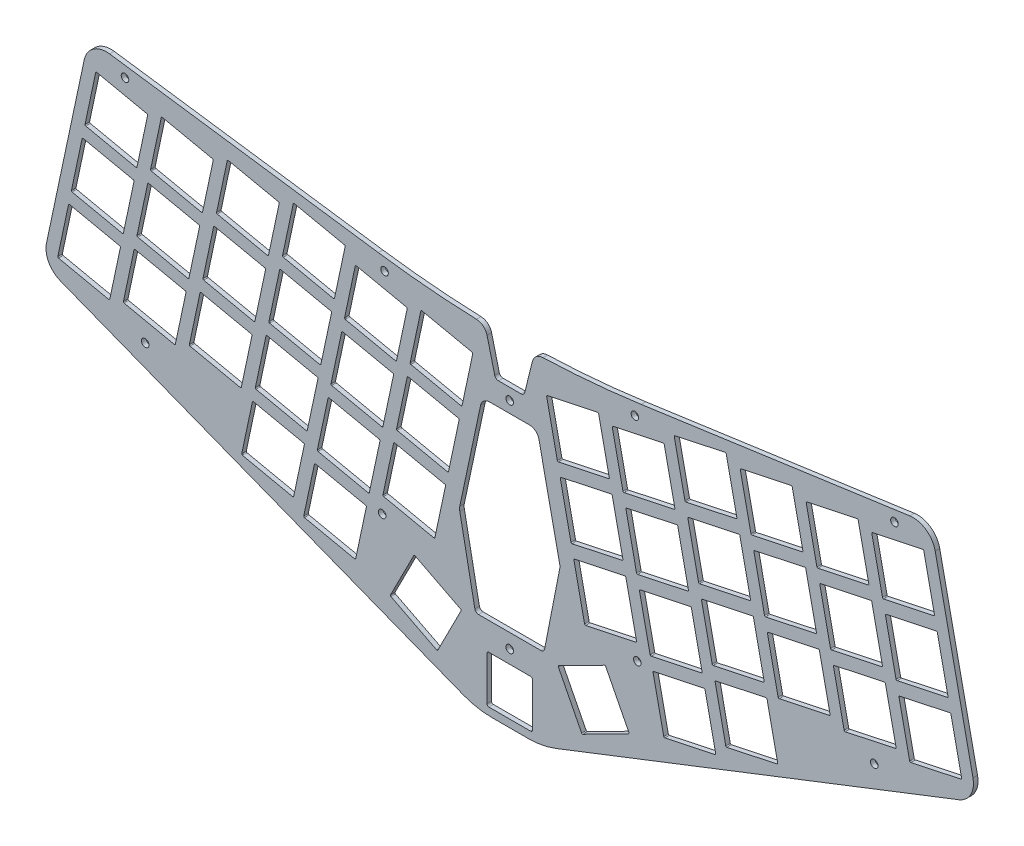
from build123d import *

# Parameters (mm, degrees)
MODEL_R             = 1
BOSS_EXTRUDE1_DEPTH = 1.2


with BuildPart() as part:
    # Model → Boss-Extrude1 (new body)
    with BuildSketch(Plane.XY):
        with BuildLine():
            Line((118.9760866, -36.3417418), (119.338629114, -36.3417418))
            ThreePointArc((119.338629114, -36.3417418), (123.033383047, -35.997499058), (126.600947758, -34.976621137))
            Line((126.600947758, -34.976621137), (130.217772945, -33.567084938))
            Line((130.217772945, -33.567084938), (232.915297986, 6.455827865))
            ThreePointArc((232.915297986, 6.455827865), (236.0167753, 9.19676994), (236.605487998, 13.293761806))
            Line((236.605487998, 13.293761806), (226.655780482, 60.103455566))
            ThreePointArc((226.655780482, 60.103455566), (224.228353496, 63.77089769), (219.95185627, 64.797593838))
            Line((219.95185627, 64.797593838), (149.130188739, 54.844257568))
            ThreePointArc((149.130188739, 54.844257568), (136.222632248, 53.372447422), (123.255880075, 52.575843528))
            ThreePointArc((123.255880075, 52.575843528), (121.473278822, 51.908806158), (120.45077354, 50.303474719))
            Line((120.45077354, 50.303474719), (118.425135625, 42.179084789))
            ThreePointArc((118.425135625, 42.179084789), (118.070501374, 41.632995931), (117.454839898, 41.421006685))
            Line((117.454839898, 41.421006685), (111.497333302, 41.421006685))
            ThreePointArc((111.497333302, 41.421006685), (110.881671826, 41.632995931), (110.527037575, 42.179084789))
            Line((110.527037575, 42.179084789), (108.50139966, 50.303474719))
            ThreePointArc((108.50139966, 50.303474719), (107.478894378, 51.908806158), (105.696293125, 52.575843528))
            ThreePointArc((105.696293125, 52.575843528), (92.729540952, 53.372447422), (79.821984461, 54.844257568))
            Line((79.821984461, 54.844257568), (9.00031693, 64.797593838))
            ThreePointArc((9.00031693, 64.797593838), (4.723819704, 63.77089769), (2.296392718, 60.103455566))
            Line((2.296392718, 60.103455566), (-7.653314798, 13.293761806))
            ThreePointArc((-7.653314798, 13.293761806), (-7.0646021, 9.19676994), (-3.963124786, 6.455827865))
            Line((-3.963124786, 6.455827865), (98.734400255, -33.567084938))
            Line((98.734400255, -33.567084938), (102.351225442, -34.976621137))
            ThreePointArc((102.351225442, -34.976621137), (105.918790153, -35.997499058), (109.613544086, -36.3417418))
            Line((109.613544086, -36.3417418), (109.9760866, -36.3417418))
            Line((109.9760866, -36.3417418), (114.4760866, -36.3417418))
            Line((114.4760866, -36.3417418), (118.9760866, -36.3417418))
        make_face()
        with Locations((215.905714612, 61.37876191)):
            Circle(MODEL_R, mode=Mode.SUBTRACT)
        with Locations((13.046458588, 61.37876191)):
            Circle(MODEL_R, mode=Mode.SUBTRACT)
        with Locations((148.11144187, -4.309774147)):
            Circle(MODEL_R, mode=Mode.SUBTRACT)
        with Locations((80.84073133, -4.309774147)):
            Circle(MODEL_R, mode=Mode.SUBTRACT)
        with Locations((210.571767278, 3.505093389)):
            Circle(MODEL_R, mode=Mode.SUBTRACT)
        with Locations((147.477927512, 51.43451951)):
            Circle(MODEL_R, mode=Mode.SUBTRACT)
        with Locations((81.474245688, 51.43451951)):
            Circle(MODEL_R, mode=Mode.SUBTRACT)
        with Locations((18.380405922, 3.505093389)):
            Circle(MODEL_R, mode=Mode.SUBTRACT)
        with Locations((114.4760866, -18.3417418)):
            Circle(MODEL_R, mode=Mode.SUBTRACT)
        with Locations((114.4760866, 38.421006685)):
            Circle(MODEL_R, mode=Mode.SUBTRACT)
        with BuildLine():
            Line((119.9760866, -34.3417418), (108.9760866, -34.3417418))
            ThreePointArc((108.9760866, -34.3417418), (108.622533209, -34.195295191), (108.4760866, -33.8417418))
            Line((108.4760866, -33.8417418), (108.4760866, -22.3417418))
            ThreePointArc((108.4760866, -22.3417418), (108.622533209, -21.988188409), (108.9760866, -21.8417418))
            Line((108.9760866, -21.8417418), (119.9760866, -21.8417418))
            ThreePointArc((119.9760866, -21.8417418), (120.329639991, -21.988188409), (120.4760866, -22.3417418))
            Line((120.4760866, -22.3417418), (120.4760866, -33.8417418))
            ThreePointArc((120.4760866, -33.8417418), (120.329639991, -34.195295191), (119.9760866, -34.3417418))
        make_face(mode=Mode.SUBTRACT)
        with BuildLine():
            Line((123.671373637, -13.757755399), (127.643452867, 6.515489672))
            ThreePointArc((127.643452867, 6.515489672), (127.699331998, 7.116248716), (127.633870359, 7.716039245))
            Line((127.633870359, 7.716039245), (122.165906686, 33.44078591))
            ThreePointArc((122.165906686, 33.44078591), (121.293838662, 34.863871588), (119.720537684, 35.421006685))
            Line((119.720537684, 35.421006685), (119.4760866, 35.421006685))
            Line((119.4760866, 35.421006685), (109.4760866, 35.421006685))
            Line((109.4760866, 35.421006685), (109.231635516, 35.421006685))
            ThreePointArc((109.231635516, 35.421006685), (107.658334538, 34.863871588), (106.786266514, 33.44078591))
            Line((106.786266514, 33.44078591), (101.318302841, 7.716039245))
            ThreePointArc((101.318302841, 7.716039245), (101.252841202, 7.116248716), (101.308720333, 6.515489672))
            Line((101.308720333, 6.515489672), (105.280799563, -13.757755399))
            ThreePointArc((105.280799563, -13.757755399), (105.626638186, -14.337582176), (106.262141333, -14.565483898))
            Line((106.262141333, -14.565483898), (122.690031867, -14.565483898))
            ThreePointArc((122.690031867, -14.565483898), (123.325535014, -14.337582176), (123.671373637, -13.757755399))
        make_face(mode=Mode.SUBTRACT)
        with BuildLine():
            Line((230.512810978, 25.123483213), (217.307818365, 22.3166754))
            ThreePointArc((217.307818365, 22.3166754), (217.150128645, 22.208298259), (217.115259387, 22.020160578))
            Line((217.115259387, 22.020160578), (219.9220672, 8.815167965))
            ThreePointArc((219.9220672, 8.815167965), (220.030444341, 8.657478245), (220.218582022, 8.622608987))
            Line((220.218582022, 8.622608987), (233.423574635, 11.4294168))
            ThreePointArc((233.423574635, 11.4294168), (233.581264355, 11.537793941), (233.616133613, 11.725931622))
            Line((233.616133613, 11.725931622), (230.8093258, 24.930924235))
            ThreePointArc((230.8093258, 24.930924235), (230.700948659, 25.088613955), (230.512810978, 25.123483213))
        make_face(mode=Mode.SUBTRACT)
        with BuildLine():
            Line((226.926334378, 41.996529313), (213.721341765, 39.1897215))
            ThreePointArc((213.721341765, 39.1897215), (213.563652045, 39.081344359), (213.528782787, 38.893206678))
            Line((213.528782787, 38.893206678), (216.3355906, 25.688214065))
            ThreePointArc((216.3355906, 25.688214065), (216.443967741, 25.530524345), (216.632105422, 25.495655087))
            Line((216.632105422, 25.495655087), (229.837098035, 28.3024629))
            ThreePointArc((229.837098035, 28.3024629), (229.994787755, 28.410840041), (230.029657013, 28.598977722))
            Line((230.029657013, 28.598977722), (227.2228492, 41.803970335))
            ThreePointArc((227.2228492, 41.803970335), (227.114472059, 41.961660055), (226.926334378, 41.996529313))
        make_face(mode=Mode.SUBTRACT)
        with BuildLine():
            Line((223.339857678, 58.869575413), (210.134865065, 56.0627676))
            ThreePointArc((210.134865065, 56.0627676), (209.977175345, 55.954390459), (209.942306087, 55.766252778))
            Line((209.942306087, 55.766252778), (212.7491139, 42.561260165))
            ThreePointArc((212.7491139, 42.561260165), (212.857491041, 42.403570445), (213.045628722, 42.368701187))
            Line((213.045628722, 42.368701187), (226.250621335, 45.175509))
            ThreePointArc((226.250621335, 45.175509), (226.408311055, 45.283886141), (226.443180313, 45.472023822))
            Line((226.443180313, 45.472023822), (223.6363725, 58.677016435))
            ThreePointArc((223.6363725, 58.677016435), (223.527995359, 58.834706155), (223.339857678, 58.869575413))
        make_face(mode=Mode.SUBTRACT)
        with BuildLine():
            Line((213.223941478, 23.493301713), (200.018948865, 20.6864939))
            ThreePointArc((200.018948865, 20.6864939), (199.861259145, 20.578116759), (199.826389887, 20.389979078))
            Line((199.826389887, 20.389979078), (202.6331977, 7.184986465))
            ThreePointArc((202.6331977, 7.184986465), (202.741574841, 7.027296745), (202.929712522, 6.992427487))
            Line((202.929712522, 6.992427487), (216.134705135, 9.7992353))
            ThreePointArc((216.134705135, 9.7992353), (216.292394855, 9.907612441), (216.327264113, 10.095750122))
            Line((216.327264113, 10.095750122), (213.5204563, 23.300742735))
            ThreePointArc((213.5204563, 23.300742735), (213.412079159, 23.458432455), (213.223941478, 23.493301713))
        make_face(mode=Mode.SUBTRACT)
        with BuildLine():
            Line((209.637464878, 40.366347913), (196.432472265, 37.5595401))
            ThreePointArc((196.432472265, 37.5595401), (196.274782545, 37.451162959), (196.239913287, 37.263025278))
            Line((196.239913287, 37.263025278), (199.0467211, 24.058032665))
            ThreePointArc((199.0467211, 24.058032665), (199.155098241, 23.900342945), (199.343235922, 23.865473687))
            Line((199.343235922, 23.865473687), (212.548228535, 26.6722815))
            ThreePointArc((212.548228535, 26.6722815), (212.705918255, 26.780658641), (212.740787513, 26.968796322))
            Line((212.740787513, 26.968796322), (209.9339797, 40.173788935))
            ThreePointArc((209.9339797, 40.173788935), (209.825602559, 40.331478655), (209.637464878, 40.366347913))
        make_face(mode=Mode.SUBTRACT)
        with BuildLine():
            Line((206.050988178, 57.239394013), (192.845995565, 54.4325862))
            ThreePointArc((192.845995565, 54.4325862), (192.688305845, 54.324209059), (192.653436587, 54.136071378))
            Line((192.653436587, 54.136071378), (195.4602444, 40.931078765))
            ThreePointArc((195.4602444, 40.931078765), (195.568621541, 40.773389045), (195.756759222, 40.738519787))
            Line((195.756759222, 40.738519787), (208.961751835, 43.5453276))
            ThreePointArc((208.961751835, 43.5453276), (209.119441555, 43.653704741), (209.154310813, 43.841842422))
            Line((209.154310813, 43.841842422), (206.347503, 57.046835035))
            ThreePointArc((206.347503, 57.046835035), (206.239125859, 57.204524755), (206.050988178, 57.239394013))
        make_face(mode=Mode.SUBTRACT)
        with BuildLine():
            Line((195.831116178, 22.352194113), (182.626123565, 19.5453863))
            ThreePointArc((182.626123565, 19.5453863), (182.468433845, 19.437009159), (182.433564587, 19.248871478))
            Line((182.433564587, 19.248871478), (185.2403724, 6.043878865))
            ThreePointArc((185.2403724, 6.043878865), (185.348749541, 5.886189145), (185.536887222, 5.851319887))
            Line((185.536887222, 5.851319887), (198.741879835, 8.6581277))
            ThreePointArc((198.741879835, 8.6581277), (198.899569555, 8.766504841), (198.934438813, 8.954642522))
            Line((198.934438813, 8.954642522), (196.127631, 22.159635135))
            ThreePointArc((196.127631, 22.159635135), (196.019253859, 22.317324855), (195.831116178, 22.352194113))
        make_face(mode=Mode.SUBTRACT)
        with BuildLine():
            Line((192.244639478, 39.225240213), (179.039646865, 36.4184324))
            ThreePointArc((179.039646865, 36.4184324), (178.881957145, 36.310055259), (178.847087887, 36.121917578))
            Line((178.847087887, 36.121917578), (181.6538957, 22.916924965))
            ThreePointArc((181.6538957, 22.916924965), (181.762272841, 22.759235245), (181.950410522, 22.724365987))
            Line((181.950410522, 22.724365987), (195.155403135, 25.5311738))
            ThreePointArc((195.155403135, 25.5311738), (195.313092855, 25.639550941), (195.347962113, 25.827688622))
            Line((195.347962113, 25.827688622), (192.5411543, 39.032681235))
            ThreePointArc((192.5411543, 39.032681235), (192.432777159, 39.190370955), (192.244639478, 39.225240213))
        make_face(mode=Mode.SUBTRACT)
        with BuildLine():
            Line((188.658162878, 56.098286313), (175.453170265, 53.2914785))
            ThreePointArc((175.453170265, 53.2914785), (175.295480545, 53.183101359), (175.260611287, 52.994963678))
            Line((175.260611287, 52.994963678), (178.0674191, 39.789971065))
            ThreePointArc((178.0674191, 39.789971065), (178.175796241, 39.632281345), (178.363933922, 39.597412087))
            Line((178.363933922, 39.597412087), (191.568926535, 42.4042199))
            ThreePointArc((191.568926535, 42.4042199), (191.726616255, 42.512597041), (191.761485513, 42.700734722))
            Line((191.761485513, 42.700734722), (188.9546777, 55.905727335))
            ThreePointArc((188.9546777, 55.905727335), (188.846300559, 56.063417055), (188.658162878, 56.098286313))
        make_face(mode=Mode.SUBTRACT)
        with BuildLine():
            Line((182.024767478, 4.338040313), (168.819774865, 1.5312325))
            ThreePointArc((168.819774865, 1.5312325), (168.662085145, 1.422855359), (168.627215887, 1.234717678))
            Line((168.627215887, 1.234717678), (171.4340237, -11.970274935))
            ThreePointArc((171.4340237, -11.970274935), (171.542400841, -12.127964655), (171.730538522, -12.162833913))
            Line((171.730538522, -12.162833913), (184.935531135, -9.3560261))
            ThreePointArc((184.935531135, -9.3560261), (185.093220855, -9.247648959), (185.128090113, -9.059511278))
            Line((185.128090113, -9.059511278), (182.3212823, 4.145481335))
            ThreePointArc((182.3212823, 4.145481335), (182.212905159, 4.303171055), (182.024767478, 4.338040313))
        make_face(mode=Mode.SUBTRACT)
        with BuildLine():
            Line((178.438290878, 21.211086413), (165.233298265, 18.4042786))
            ThreePointArc((165.233298265, 18.4042786), (165.075608545, 18.295901459), (165.040739287, 18.107763778))
            Line((165.040739287, 18.107763778), (167.8475471, 4.902771165))
            ThreePointArc((167.8475471, 4.902771165), (167.955924241, 4.745081445), (168.144061922, 4.710212187))
            Line((168.144061922, 4.710212187), (181.349054535, 7.51702))
            ThreePointArc((181.349054535, 7.51702), (181.506744255, 7.625397141), (181.541613513, 7.813534822))
            Line((181.541613513, 7.813534822), (178.7348057, 21.018527435))
            ThreePointArc((178.7348057, 21.018527435), (178.626428559, 21.176217155), (178.438290878, 21.211086413))
        make_face(mode=Mode.SUBTRACT)
        with BuildLine():
            Line((174.851814178, 38.084132513), (161.646821565, 35.2773247))
            ThreePointArc((161.646821565, 35.2773247), (161.489131845, 35.168947559), (161.454262587, 34.980809878))
            Line((161.454262587, 34.980809878), (164.2610704, 21.775817265))
            ThreePointArc((164.2610704, 21.775817265), (164.369447541, 21.618127545), (164.557585222, 21.583258287))
            Line((164.557585222, 21.583258287), (177.762577835, 24.3900661))
            ThreePointArc((177.762577835, 24.3900661), (177.920267555, 24.498443241), (177.955136813, 24.686580922))
            Line((177.955136813, 24.686580922), (175.148329, 37.891573535))
            ThreePointArc((175.148329, 37.891573535), (175.039951859, 38.049263255), (174.851814178, 38.084132513))
        make_face(mode=Mode.SUBTRACT)
        with BuildLine():
            Line((171.265337478, 54.957178613), (158.060344865, 52.1503708))
            ThreePointArc((158.060344865, 52.1503708), (157.902655145, 52.041993659), (157.867785887, 51.853855978))
            Line((157.867785887, 51.853855978), (160.6745937, 38.648863365))
            ThreePointArc((160.6745937, 38.648863365), (160.782970841, 38.491173645), (160.971108522, 38.456304387))
            Line((160.971108522, 38.456304387), (174.176101135, 41.2631122))
            ThreePointArc((174.176101135, 41.2631122), (174.333790855, 41.371489341), (174.368660113, 41.559627022))
            Line((174.368660113, 41.559627022), (171.5618523, 54.764619635))
            ThreePointArc((171.5618523, 54.764619635), (171.453475159, 54.922309355), (171.265337478, 54.957178613))
        make_face(mode=Mode.SUBTRACT)
        with BuildLine():
            Line((165.671500578, -1.693805387), (152.466507965, -4.5006132))
            ThreePointArc((152.466507965, -4.5006132), (152.308818245, -4.608990341), (152.273948987, -4.797128022))
            Line((152.273948987, -4.797128022), (155.0807568, -18.002120635))
            ThreePointArc((155.0807568, -18.002120635), (155.189133941, -18.159810355), (155.377271622, -18.194679613))
            Line((155.377271622, -18.194679613), (168.582264235, -15.3878718))
            ThreePointArc((168.582264235, -15.3878718), (168.739953955, -15.279494659), (168.774823213, -15.091356978))
            Line((168.774823213, -15.091356978), (165.9680154, -1.886364365))
            ThreePointArc((165.9680154, -1.886364365), (165.859638259, -1.728674645), (165.671500578, -1.693805387))
        make_face(mode=Mode.SUBTRACT)
        with BuildLine():
            Line((162.085023978, 15.179240713), (148.880031365, 12.3724329))
            ThreePointArc((148.880031365, 12.3724329), (148.722341645, 12.264055759), (148.687472387, 12.075918078))
            Line((148.687472387, 12.075918078), (151.4942802, -1.129074535))
            ThreePointArc((151.4942802, -1.129074535), (151.602657341, -1.286764255), (151.790795022, -1.321633513))
            Line((151.790795022, -1.321633513), (164.995787635, 1.4851743))
            ThreePointArc((164.995787635, 1.4851743), (165.153477355, 1.593551441), (165.188346613, 1.781689122))
            Line((165.188346613, 1.781689122), (162.3815388, 14.986681735))
            ThreePointArc((162.3815388, 14.986681735), (162.273161659, 15.144371455), (162.085023978, 15.179240713))
        make_face(mode=Mode.SUBTRACT)
        with BuildLine():
            Line((158.498547278, 32.052286913), (145.293554665, 29.2454791))
            ThreePointArc((145.293554665, 29.2454791), (145.135864945, 29.137101959), (145.100995687, 28.948964278))
            Line((145.100995687, 28.948964278), (147.9078035, 15.743971665))
            ThreePointArc((147.9078035, 15.743971665), (148.016180641, 15.586281945), (148.204318322, 15.551412687))
            Line((148.204318322, 15.551412687), (161.409310935, 18.3582205))
            ThreePointArc((161.409310935, 18.3582205), (161.567000655, 18.466597641), (161.601869913, 18.654735322))
            Line((161.601869913, 18.654735322), (158.7950621, 31.859727935))
            ThreePointArc((158.7950621, 31.859727935), (158.686684959, 32.017417655), (158.498547278, 32.052286913))
        make_face(mode=Mode.SUBTRACT)
        with BuildLine():
            Line((154.912070578, 48.925333013), (141.707077965, 46.1185252))
            ThreePointArc((141.707077965, 46.1185252), (141.549388245, 46.010148059), (141.514518987, 45.822010378))
            Line((141.514518987, 45.822010378), (144.3213268, 32.617017765))
            ThreePointArc((144.3213268, 32.617017765), (144.429703941, 32.459328045), (144.617841622, 32.424458787))
            Line((144.617841622, 32.424458787), (157.822834235, 35.2312666))
            ThreePointArc((157.822834235, 35.2312666), (157.980523955, 35.339643741), (158.015393213, 35.527781422))
            Line((158.015393213, 35.527781422), (155.2085854, 48.732774035))
            ThreePointArc((155.2085854, 48.732774035), (155.100208259, 48.890463755), (154.912070578, 48.925333013))
        make_face(mode=Mode.SUBTRACT)
        with BuildLine():
            Line((137.623201078, 47.295151513), (124.418208465, 44.4883437))
            ThreePointArc((124.418208465, 44.4883437), (124.260518745, 44.379966559), (124.225649487, 44.191828878))
            Line((124.225649487, 44.191828878), (127.0324573, 30.986836265))
            ThreePointArc((127.0324573, 30.986836265), (127.140834441, 30.829146545), (127.328972122, 30.794277287))
            Line((127.328972122, 30.794277287), (140.533964735, 33.6010851))
            ThreePointArc((140.533964735, 33.6010851), (140.691654455, 33.709462241), (140.726523713, 33.897599922))
            Line((140.726523713, 33.897599922), (137.9197159, 47.102592535))
            ThreePointArc((137.9197159, 47.102592535), (137.811338759, 47.260282255), (137.623201078, 47.295151513))
        make_face(mode=Mode.SUBTRACT)
        with BuildLine():
            Line((141.209677778, 30.422105413), (128.004685165, 27.6152976))
            ThreePointArc((128.004685165, 27.6152976), (127.846995445, 27.506920459), (127.812126187, 27.318782778))
            Line((127.812126187, 27.318782778), (130.618934, 14.113790165))
            ThreePointArc((130.618934, 14.113790165), (130.727311141, 13.956100445), (130.915448822, 13.921231187))
            Line((130.915448822, 13.921231187), (144.120441435, 16.728039))
            ThreePointArc((144.120441435, 16.728039), (144.278131155, 16.836416141), (144.313000413, 17.024553822))
            Line((144.313000413, 17.024553822), (141.5061926, 30.229546435))
            ThreePointArc((141.5061926, 30.229546435), (141.397815459, 30.387236155), (141.209677778, 30.422105413))
        make_face(mode=Mode.SUBTRACT)
        with BuildLine():
            Line((144.796154478, 13.549059313), (131.591161865, 10.7422515))
            ThreePointArc((131.591161865, 10.7422515), (131.433472145, 10.633874359), (131.398602887, 10.445736678))
            Line((131.398602887, 10.445736678), (134.2054107, -2.759255935))
            ThreePointArc((134.2054107, -2.759255935), (134.313787841, -2.916945655), (134.501925522, -2.951814913))
            Line((134.501925522, -2.951814913), (147.706918135, -0.1450071))
            ThreePointArc((147.706918135, -0.1450071), (147.864607855, -0.036629959), (147.899477113, 0.151507722))
            Line((147.899477113, 0.151507722), (145.0926693, 13.356500335))
            ThreePointArc((145.0926693, 13.356500335), (144.984292159, 13.514190055), (144.796154478, 13.549059313))
        make_face(mode=Mode.SUBTRACT)
        with BuildLine():
            Line((139.442188676, -9.560584668), (127.413600576, -15.689456368))
            ThreePointArc((127.413600576, -15.689456368), (127.289334071, -15.83495375), (127.304346568, -16.025705624))
            Line((127.304346568, -16.025705624), (133.433218268, -28.054293724))
            ThreePointArc((133.433218268, -28.054293724), (133.57871565, -28.178560229), (133.769467524, -28.163547732))
            Line((133.769467524, -28.163547732), (145.798055624, -22.034676032))
            ThreePointArc((145.798055624, -22.034676032), (145.922322129, -21.88917865), (145.907309632, -21.698426776))
            Line((145.907309632, -21.698426776), (139.778437932, -9.669838676))
            ThreePointArc((139.778437932, -9.669838676), (139.63294055, -9.545572171), (139.442188676, -9.560584668))
        make_face(mode=Mode.SUBTRACT)
        with BuildLine():
            Line((101.538572624, -15.689456368), (89.509984524, -9.560584668))
            ThreePointArc((89.509984524, -9.560584668), (89.31923265, -9.545572171), (89.173735268, -9.669838676))
            Line((89.173735268, -9.669838676), (83.044863568, -21.698426776))
            ThreePointArc((83.044863568, -21.698426776), (83.029851071, -21.88917865), (83.154117576, -22.034676032))
            Line((83.154117576, -22.034676032), (95.182705676, -28.163547732))
            ThreePointArc((95.182705676, -28.163547732), (95.37345755, -28.178560229), (95.518954932, -28.054293724))
            Line((95.518954932, -28.054293724), (101.647826632, -16.025705624))
            ThreePointArc((101.647826632, -16.025705624), (101.662839129, -15.83495375), (101.538572624, -15.689456368))
        make_face(mode=Mode.SUBTRACT)
        with BuildLine():
            Line((97.361011335, 10.7422515), (84.156018722, 13.549059313))
            ThreePointArc((84.156018722, 13.549059313), (83.967881041, 13.514190055), (83.8595039, 13.356500335))
            Line((83.8595039, 13.356500335), (81.052696087, 0.151507722))
            ThreePointArc((81.052696087, 0.151507722), (81.087565345, -0.036629959), (81.245255065, -0.1450071))
            Line((81.245255065, -0.1450071), (94.450247678, -2.951814913))
            ThreePointArc((94.450247678, -2.951814913), (94.638385359, -2.916945655), (94.7467625, -2.759255935))
            Line((94.7467625, -2.759255935), (97.553570313, 10.445736678))
            ThreePointArc((97.553570313, 10.445736678), (97.518701055, 10.633874359), (97.361011335, 10.7422515))
        make_face(mode=Mode.SUBTRACT)
        with BuildLine():
            Line((100.947488035, 27.6152976), (87.742495422, 30.422105413))
            ThreePointArc((87.742495422, 30.422105413), (87.554357741, 30.387236155), (87.4459806, 30.229546435))
            Line((87.4459806, 30.229546435), (84.639172787, 17.024553822))
            ThreePointArc((84.639172787, 17.024553822), (84.674042045, 16.836416141), (84.831731765, 16.728039))
            Line((84.831731765, 16.728039), (98.036724378, 13.921231187))
            ThreePointArc((98.036724378, 13.921231187), (98.224862059, 13.956100445), (98.3332392, 14.113790165))
            Line((98.3332392, 14.113790165), (101.140047013, 27.318782778))
            ThreePointArc((101.140047013, 27.318782778), (101.105177755, 27.506920459), (100.947488035, 27.6152976))
        make_face(mode=Mode.SUBTRACT)
        with BuildLine():
            Line((104.533964735, 44.4883437), (91.328972122, 47.295151513))
            ThreePointArc((91.328972122, 47.295151513), (91.140834441, 47.260282255), (91.0324573, 47.102592535))
            Line((91.0324573, 47.102592535), (88.225649487, 33.897599922))
            ThreePointArc((88.225649487, 33.897599922), (88.260518745, 33.709462241), (88.418208465, 33.6010851))
            Line((88.418208465, 33.6010851), (101.623201078, 30.794277287))
            ThreePointArc((101.623201078, 30.794277287), (101.811338759, 30.829146545), (101.9197159, 30.986836265))
            Line((101.9197159, 30.986836265), (104.726523713, 44.191828878))
            ThreePointArc((104.726523713, 44.191828878), (104.691654455, 44.379966559), (104.533964735, 44.4883437))
        make_face(mode=Mode.SUBTRACT)
        with BuildLine():
            Line((76.485665235, -4.5006132), (63.280672622, -1.693805387))
            ThreePointArc((63.280672622, -1.693805387), (63.092534941, -1.728674645), (62.9841578, -1.886364365))
            Line((62.9841578, -1.886364365), (60.177349987, -15.091356978))
            ThreePointArc((60.177349987, -15.091356978), (60.212219245, -15.279494659), (60.369908965, -15.3878718))
            Line((60.369908965, -15.3878718), (73.574901578, -18.194679613))
            ThreePointArc((73.574901578, -18.194679613), (73.763039259, -18.159810355), (73.8714164, -18.002120635))
            Line((73.8714164, -18.002120635), (76.678224213, -4.797128022))
            ThreePointArc((76.678224213, -4.797128022), (76.643354955, -4.608990341), (76.485665235, -4.5006132))
        make_face(mode=Mode.SUBTRACT)
        with BuildLine():
            Line((80.072141835, 12.3724329), (66.867149222, 15.179240713))
            ThreePointArc((66.867149222, 15.179240713), (66.679011541, 15.144371455), (66.5706344, 14.986681735))
            Line((66.5706344, 14.986681735), (63.763826587, 1.781689122))
            ThreePointArc((63.763826587, 1.781689122), (63.798695845, 1.593551441), (63.956385565, 1.4851743))
            Line((63.956385565, 1.4851743), (77.161378178, -1.321633513))
            ThreePointArc((77.161378178, -1.321633513), (77.349515859, -1.286764255), (77.457893, -1.129074535))
            Line((77.457893, -1.129074535), (80.264700813, 12.075918078))
            ThreePointArc((80.264700813, 12.075918078), (80.229831555, 12.264055759), (80.072141835, 12.3724329))
        make_face(mode=Mode.SUBTRACT)
        with BuildLine():
            Line((83.658618535, 29.2454791), (70.453625922, 32.052286913))
            ThreePointArc((70.453625922, 32.052286913), (70.265488241, 32.017417655), (70.1571111, 31.859727935))
            Line((70.1571111, 31.859727935), (67.350303287, 18.654735322))
            ThreePointArc((67.350303287, 18.654735322), (67.385172545, 18.466597641), (67.542862265, 18.3582205))
            Line((67.542862265, 18.3582205), (80.747854878, 15.551412687))
            ThreePointArc((80.747854878, 15.551412687), (80.935992559, 15.586281945), (81.0443697, 15.743971665))
            Line((81.0443697, 15.743971665), (83.851177513, 28.948964278))
            ThreePointArc((83.851177513, 28.948964278), (83.816308255, 29.137101959), (83.658618535, 29.2454791))
        make_face(mode=Mode.SUBTRACT)
        with BuildLine():
            Line((87.245095235, 46.1185252), (74.040102622, 48.925333013))
            ThreePointArc((74.040102622, 48.925333013), (73.851964941, 48.890463755), (73.7435878, 48.732774035))
            Line((73.7435878, 48.732774035), (70.936779987, 35.527781422))
            ThreePointArc((70.936779987, 35.527781422), (70.971649245, 35.339643741), (71.129338965, 35.2312666))
            Line((71.129338965, 35.2312666), (84.334331578, 32.424458787))
            ThreePointArc((84.334331578, 32.424458787), (84.522469259, 32.459328045), (84.6308464, 32.617017765))
            Line((84.6308464, 32.617017765), (87.437654213, 45.822010378))
            ThreePointArc((87.437654213, 45.822010378), (87.402784955, 46.010148059), (87.245095235, 46.1185252))
        make_face(mode=Mode.SUBTRACT)
        with BuildLine():
            Line((60.132398335, 1.5312325), (46.927405722, 4.338040313))
            ThreePointArc((46.927405722, 4.338040313), (46.739268041, 4.303171055), (46.6308909, 4.145481335))
            Line((46.6308909, 4.145481335), (43.824083087, -9.059511278))
            ThreePointArc((43.824083087, -9.059511278), (43.858952345, -9.247648959), (44.016642065, -9.3560261))
            Line((44.016642065, -9.3560261), (57.221634678, -12.162833913))
            ThreePointArc((57.221634678, -12.162833913), (57.409772359, -12.127964655), (57.5181495, -11.970274935))
            Line((57.5181495, -11.970274935), (60.324957313, 1.234717678))
            ThreePointArc((60.324957313, 1.234717678), (60.290088055, 1.422855359), (60.132398335, 1.5312325))
        make_face(mode=Mode.SUBTRACT)
        with BuildLine():
            Line((63.718874935, 18.4042786), (50.513882322, 21.211086413))
            ThreePointArc((50.513882322, 21.211086413), (50.325744641, 21.176217155), (50.2173675, 21.018527435))
            Line((50.2173675, 21.018527435), (47.410559687, 7.813534822))
            ThreePointArc((47.410559687, 7.813534822), (47.445428945, 7.625397141), (47.603118665, 7.51702))
            Line((47.603118665, 7.51702), (60.808111278, 4.710212187))
            ThreePointArc((60.808111278, 4.710212187), (60.996248959, 4.745081445), (61.1046261, 4.902771165))
            Line((61.1046261, 4.902771165), (63.911433913, 18.107763778))
            ThreePointArc((63.911433913, 18.107763778), (63.876564655, 18.295901459), (63.718874935, 18.4042786))
        make_face(mode=Mode.SUBTRACT)
        with BuildLine():
            Line((67.305351635, 35.2773247), (54.100359022, 38.084132513))
            ThreePointArc((54.100359022, 38.084132513), (53.912221341, 38.049263255), (53.8038442, 37.891573535))
            Line((53.8038442, 37.891573535), (50.997036387, 24.686580922))
            ThreePointArc((50.997036387, 24.686580922), (51.031905645, 24.498443241), (51.189595365, 24.3900661))
            Line((51.189595365, 24.3900661), (64.394587978, 21.583258287))
            ThreePointArc((64.394587978, 21.583258287), (64.582725659, 21.618127545), (64.6911028, 21.775817265))
            Line((64.6911028, 21.775817265), (67.497910613, 34.980809878))
            ThreePointArc((67.497910613, 34.980809878), (67.463041355, 35.168947559), (67.305351635, 35.2773247))
        make_face(mode=Mode.SUBTRACT)
        with BuildLine():
            Line((70.891828335, 52.1503708), (57.686835722, 54.957178613))
            ThreePointArc((57.686835722, 54.957178613), (57.498698041, 54.922309355), (57.3903209, 54.764619635))
            Line((57.3903209, 54.764619635), (54.583513087, 41.559627022))
            ThreePointArc((54.583513087, 41.559627022), (54.618382345, 41.371489341), (54.776072065, 41.2631122))
            Line((54.776072065, 41.2631122), (67.981064678, 38.456304387))
            ThreePointArc((67.981064678, 38.456304387), (68.169202359, 38.491173645), (68.2775795, 38.648863365))
            Line((68.2775795, 38.648863365), (71.084387313, 51.853855978))
            ThreePointArc((71.084387313, 51.853855978), (71.049518055, 52.041993659), (70.891828335, 52.1503708))
        make_face(mode=Mode.SUBTRACT)
        with BuildLine():
            Line((46.518608613, 19.248871478), (45.115204707, 12.646375171))
            Line((45.115204707, 12.646375171), (43.7118008, 6.043878865))
            ThreePointArc((43.7118008, 6.043878865), (43.603423659, 5.886189145), (43.415285978, 5.851319887))
            Line((43.415285978, 5.851319887), (30.210293365, 8.6581277))
            ThreePointArc((30.210293365, 8.6581277), (30.052603645, 8.766504841), (30.017734387, 8.954642522))
            Line((30.017734387, 8.954642522), (32.8245422, 22.159635135))
            ThreePointArc((32.8245422, 22.159635135), (32.932919341, 22.317324855), (33.121057022, 22.352194113))
            Line((33.121057022, 22.352194113), (46.326049635, 19.5453863))
            ThreePointArc((46.326049635, 19.5453863), (46.483739355, 19.437009159), (46.518608613, 19.248871478))
        make_face(mode=Mode.SUBTRACT)
        with BuildLine():
            Line((50.105085313, 36.121917578), (48.701681407, 29.519421271))
            Line((48.701681407, 29.519421271), (47.2982775, 22.916924965))
            ThreePointArc((47.2982775, 22.916924965), (47.189900359, 22.759235245), (47.001762678, 22.724365987))
            Line((47.001762678, 22.724365987), (33.796770065, 25.5311738))
            ThreePointArc((33.796770065, 25.5311738), (33.639080345, 25.639550941), (33.604211087, 25.827688622))
            Line((33.604211087, 25.827688622), (36.4110189, 39.032681235))
            ThreePointArc((36.4110189, 39.032681235), (36.519396041, 39.190370955), (36.707533722, 39.225240213))
            Line((36.707533722, 39.225240213), (49.912526335, 36.4184324))
            ThreePointArc((49.912526335, 36.4184324), (50.070216055, 36.310055259), (50.105085313, 36.121917578))
        make_face(mode=Mode.SUBTRACT)
        with BuildLine():
            Line((53.691561913, 52.994963678), (52.288158007, 46.392467371))
            Line((52.288158007, 46.392467371), (50.8847541, 39.789971065))
            ThreePointArc((50.8847541, 39.789971065), (50.776376959, 39.632281345), (50.588239278, 39.597412087))
            Line((50.588239278, 39.597412087), (37.383246665, 42.4042199))
            ThreePointArc((37.383246665, 42.4042199), (37.225556945, 42.512597041), (37.190687687, 42.700734722))
            Line((37.190687687, 42.700734722), (39.9974955, 55.905727335))
            ThreePointArc((39.9974955, 55.905727335), (40.105872641, 56.063417055), (40.294010322, 56.098286313))
            Line((40.294010322, 56.098286313), (53.499002935, 53.2914785))
            ThreePointArc((53.499002935, 53.2914785), (53.656692655, 53.183101359), (53.691561913, 52.994963678))
        make_face(mode=Mode.SUBTRACT)
        with BuildLine():
            Line((29.125783313, 20.389979078), (27.722379407, 13.787482771))
            Line((27.722379407, 13.787482771), (26.3189755, 7.184986465))
            ThreePointArc((26.3189755, 7.184986465), (26.210598359, 7.027296745), (26.022460678, 6.992427487))
            Line((26.022460678, 6.992427487), (12.817468065, 9.7992353))
            ThreePointArc((12.817468065, 9.7992353), (12.659778345, 9.907612441), (12.624909087, 10.095750122))
            Line((12.624909087, 10.095750122), (15.4317169, 23.300742735))
            ThreePointArc((15.4317169, 23.300742735), (15.540094041, 23.458432455), (15.728231722, 23.493301713))
            Line((15.728231722, 23.493301713), (28.933224335, 20.6864939))
            ThreePointArc((28.933224335, 20.6864939), (29.090914055, 20.578116759), (29.125783313, 20.389979078))
        make_face(mode=Mode.SUBTRACT)
        with BuildLine():
            Line((32.712259913, 37.263025278), (31.308856007, 30.660528971))
            Line((31.308856007, 30.660528971), (29.9054521, 24.058032665))
            ThreePointArc((29.9054521, 24.058032665), (29.797074959, 23.900342945), (29.608937278, 23.865473687))
            Line((29.608937278, 23.865473687), (16.403944665, 26.6722815))
            ThreePointArc((16.403944665, 26.6722815), (16.246254945, 26.780658641), (16.211385687, 26.968796322))
            Line((16.211385687, 26.968796322), (19.0181935, 40.173788935))
            ThreePointArc((19.0181935, 40.173788935), (19.126570641, 40.331478655), (19.314708322, 40.366347913))
            Line((19.314708322, 40.366347913), (32.519700935, 37.5595401))
            ThreePointArc((32.519700935, 37.5595401), (32.677390655, 37.451162959), (32.712259913, 37.263025278))
        make_face(mode=Mode.SUBTRACT)
        with BuildLine():
            Line((19.797862387, 43.841842422), (21.201266293, 50.444338729))
            Line((21.201266293, 50.444338729), (22.6046702, 57.046835035))
            ThreePointArc((22.6046702, 57.046835035), (22.713047341, 57.204524755), (22.901185022, 57.239394013))
            Line((22.901185022, 57.239394013), (36.106177635, 54.4325862))
            ThreePointArc((36.106177635, 54.4325862), (36.263867355, 54.324209059), (36.298736613, 54.136071378))
            Line((36.298736613, 54.136071378), (33.4919288, 40.931078765))
            ThreePointArc((33.4919288, 40.931078765), (33.383551659, 40.773389045), (33.195413978, 40.738519787))
            Line((33.195413978, 40.738519787), (19.990421365, 43.5453276))
            ThreePointArc((19.990421365, 43.5453276), (19.832731645, 43.653704741), (19.797862387, 43.841842422))
        make_face(mode=Mode.SUBTRACT)
        with BuildLine():
            Line((-4.663960413, 11.725931622), (-3.260556507, 18.328427929))
            Line((-3.260556507, 18.328427929), (-1.8571526, 24.930924235))
            ThreePointArc((-1.8571526, 24.930924235), (-1.748775459, 25.088613955), (-1.560637778, 25.123483213))
            Line((-1.560637778, 25.123483213), (11.644354835, 22.3166754))
            ThreePointArc((11.644354835, 22.3166754), (11.802044555, 22.208298259), (11.836913813, 22.020160578))
            Line((11.836913813, 22.020160578), (9.030106, 8.815167965))
            ThreePointArc((9.030106, 8.815167965), (8.921728859, 8.657478245), (8.733591178, 8.622608987))
            Line((8.733591178, 8.622608987), (-4.471401435, 11.4294168))
            ThreePointArc((-4.471401435, 11.4294168), (-4.629091155, 11.537793941), (-4.663960413, 11.725931622))
        make_face(mode=Mode.SUBTRACT)
        with BuildLine():
            Line((15.230831435, 39.1897215), (8.628335129, 40.593125407))
            Line((8.628335129, 40.593125407), (2.025838822, 41.996529313))
            ThreePointArc((2.025838822, 41.996529313), (1.837701141, 41.961660055), (1.729324, 41.803970335))
            Line((1.729324, 41.803970335), (-1.077483813, 28.598977722))
            ThreePointArc((-1.077483813, 28.598977722), (-1.042614555, 28.410840041), (-0.884924835, 28.3024629))
            Line((-0.884924835, 28.3024629), (12.320067778, 25.495655087))
            ThreePointArc((12.320067778, 25.495655087), (12.508205459, 25.530524345), (12.6165826, 25.688214065))
            Line((12.6165826, 25.688214065), (15.423390413, 38.893206678))
            ThreePointArc((15.423390413, 38.893206678), (15.388521155, 39.081344359), (15.230831435, 39.1897215))
        make_face(mode=Mode.SUBTRACT)
        with BuildLine():
            Line((2.508992887, 45.472023822), (3.912396793, 52.074520129))
            Line((3.912396793, 52.074520129), (5.3158007, 58.677016435))
            ThreePointArc((5.3158007, 58.677016435), (5.424177841, 58.834706155), (5.612315522, 58.869575413))
            Line((5.612315522, 58.869575413), (18.817308135, 56.0627676))
            ThreePointArc((18.817308135, 56.0627676), (18.974997855, 55.954390459), (19.009867113, 55.766252778))
            Line((19.009867113, 55.766252778), (16.2030593, 42.561260165))
            ThreePointArc((16.2030593, 42.561260165), (16.094682159, 42.403570445), (15.906544478, 42.368701187))
            Line((15.906544478, 42.368701187), (2.701551865, 45.175509))
            ThreePointArc((2.701551865, 45.175509), (2.543862145, 45.283886141), (2.508992887, 45.472023822))
        make_face(mode=Mode.SUBTRACT)
    extrude(amount=BOSS_EXTRUDE1_DEPTH)


solid = part.part
